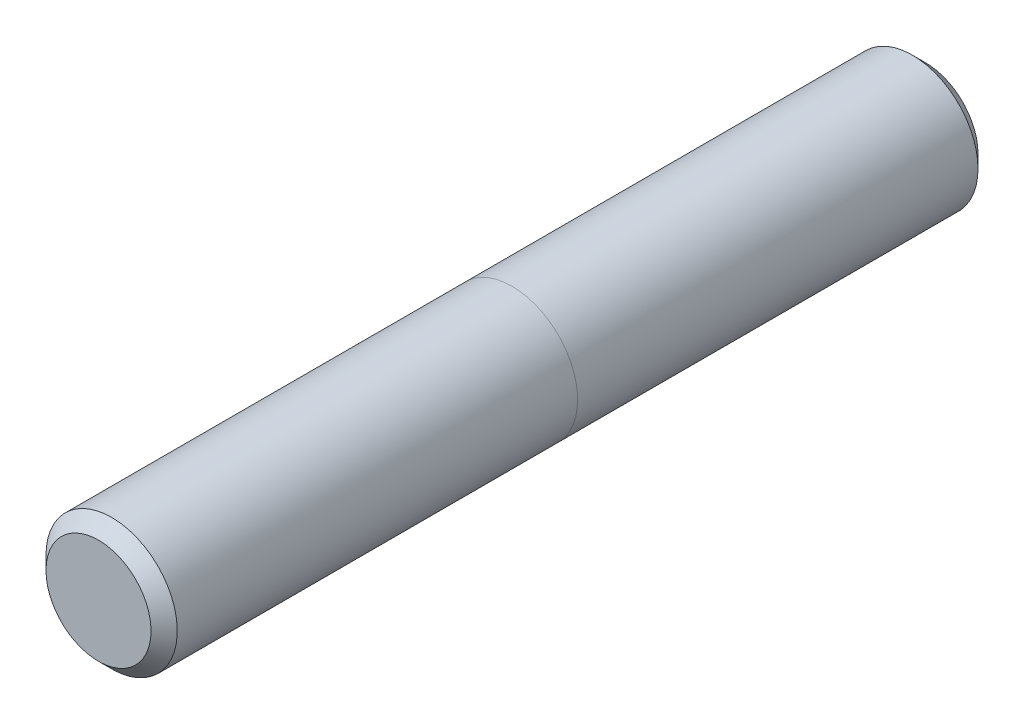
from build123d import *

# Parameters (mm, degrees)
SKETCH3_R           = 7.9375
BOSS_EXTRUDE1_DEPTH = 50
CHAMFER1_SIZE       = 1.5875


with BuildPart() as part:
    # Sketch3 → Boss-Extrude1 (new, symmetric)
    with BuildSketch(Plane.XY):
        Circle(SKETCH3_R)
    extrude(amount=BOSS_EXTRUDE1_DEPTH, both=True)

    # Chamfer1
    chamfer1_edges = [part.edges().sort_by_distance(p)[0] for p in [
        (-7.9375, 0, -50),
        (-7.9375, 0, 50),
    ]]
    chamfer(chamfer1_edges, length=CHAMFER1_SIZE)


solid = part.part
